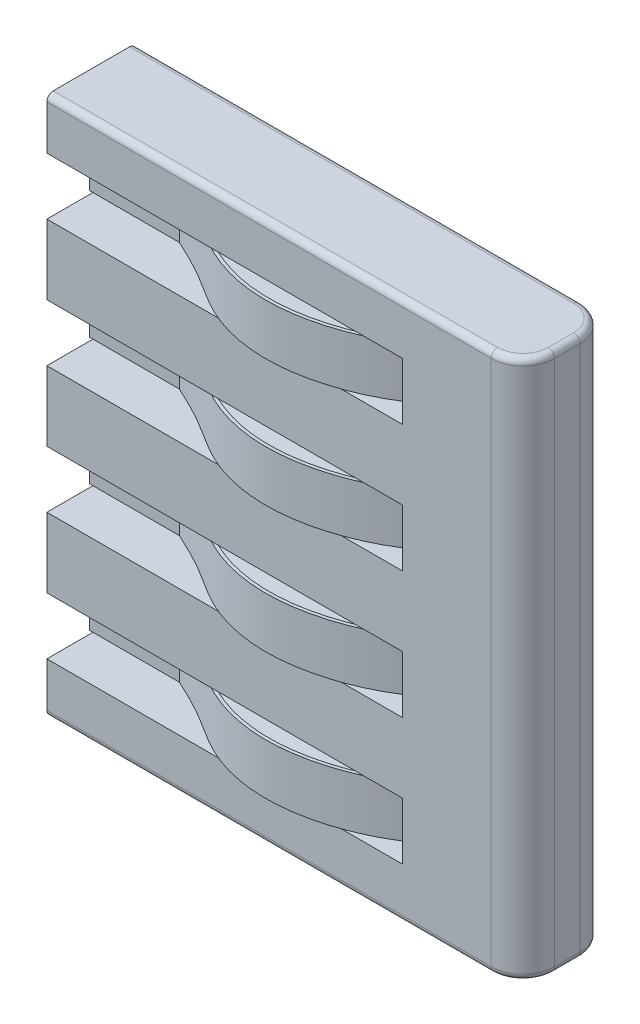
from build123d import *

# Parameters (mm, degrees)
SKETCH1_W           = 9.525
SKETCH1_H           = 10.795
BOSS_EXTRUDE1_DEPTH = 0.889
SKETCH2_W           = 7.112
SKETCH2_H           = 1.143
CUT_EXTRUDE1_DEPTH  = 1.27
LPATTERN1_COUNT     = 4
LPATTERN1_PITCH     = 2.54
SWEEP1_START        = 3.302
SWEEP1_DEPTH        = 1.016
LPATTERN2_COUNT     = 4
LPATTERN2_PITCH     = 2.54
CUT_EXTRUDE2_DEPTH  = 12.8580274
FILLET2_R           = 0.127


# Read off the part's stored shape, not the designer's step: Sweep1
with BuildPart() as part:
    # Sketch1 → Boss-Extrude1 (new, symmetric)
    with BuildSketch(Plane.XY):
        Rectangle(SKETCH1_W, SKETCH1_H)
    extrude(amount=BOSS_EXTRUDE1_DEPTH, both=True)

    # Sketch2 → Cut-Extrude1 (cut)
    with BuildSketch(Plane.XY.offset(0.889)):
        with Locations((-1.2065, 3.81)):
            Rectangle(SKETCH2_W, SKETCH2_H)
    cut_extrude1 = extrude(amount=-CUT_EXTRUDE1_DEPTH, mode=Mode.SUBTRACT)

    # LPattern1: Cut-Extrude1 ×4
    with Locations(*[(0, -i * LPATTERN1_PITCH, 0) for i in range(1, LPATTERN1_COUNT)]):
        add(cut_extrude1, mode=Mode.SUBTRACT)

    # Sweep1 outline → Sweep1 (add)
    with BuildSketch(Plane(origin=(0, 0, 0), x_dir=(1, 0, 0), z_dir=(0, 1, 0)).offset(SWEEP1_START)):
        with BuildLine():
            add(Edge.make_bspline(
                [(-2.958664485, 0.03175), (-2.706405798, -0.084396657), (-2.195293689, -0.319726362), (-1.514674501, -0.811036045), (-0.723468732, -1.093477281), (0.111091297, -1.1480463), (0.950883413, -0.99405052), (1.715489301, -0.68557292), (2.154910348, -0.386399802), (2.3495, -0.248288405)],
                knots=[0, 0, 0, 0, 0.1400972, 0.283856925, 0.421522391, 0.557109715, 0.701349819, 0.849245032, 0.969367335, 0.969367335, 0.969367335, 0.969367335], degree=3))
            Line((-2.958664485, 0.03175), (-4.7625, 0.03175))
            Line((-4.7625, 0.03175), (-4.7625, -0.03175))
            Line((-4.7625, -0.03175), (-2.968725914, -0.03175))
            add(Edge.make_bspline(
                [(-2.968725914, -0.03175), (-2.714491455, -0.15140088), (-2.19937615, -0.393830641), (-1.50930601, -0.887085656), (-0.710525949, -1.159958237), (0.131263589, -1.2104677), (0.978085908, -1.052203574), (1.73427594, -0.74581201), (2.165863748, -0.455666821), (2.3495, -0.326036057)],
                knots=[0, 0, 0, 0, 0.1400972, 0.283856925, 0.421522391, 0.557109715, 0.701349819, 0.849245032, 0.961516171, 0.961516171, 0.961516171, 0.961516171], degree=3))
            Line((2.3495, -0.326036057), (2.3495, -0.248288405))
        make_face()
    sweep1 = extrude(amount=SWEEP1_DEPTH)

    # LPattern2: Sweep1 ×4
    with Locations(*[(0, -i * LPATTERN2_PITCH, 0) for i in range(1, LPATTERN2_COUNT)]):
        add(sweep1)

    # Sketch5 → Cut-Extrude2 (cut, through all)
    with BuildSketch(Plane.XZ.offset(5.3975)):
        with BuildLine():
            Line((4.1275, 0.889), (4.830136411, 0.889))
            Line((4.830136411, 0.889), (4.830136411, -0.889))
            Line((4.830136411, -0.889), (4.1275, -0.889))
            ThreePointArc((4.1275, -0.889), (4.576512806, -0.703012806), (4.7625, -0.254))
            Line((4.7625, -0.254), (4.7625, 0.254))
            ThreePointArc((4.7625, 0.254), (4.576512806, 0.703012806), (4.1275, 0.889))
        make_face()
    extrude(amount=-CUT_EXTRUDE2_DEPTH, mode=Mode.SUBTRACT)

    # Fillet2
    fillet2_edges = [part.edges().sort_by_distance(p)[0] for p in [
        (-0.3175, -5.3975, 0.889),
        (-0.3175, 5.3975, -0.889),
        (-0.3175, 5.3975, 0.889),
        (4.7625, -5.3975, 0),
        (4.7625, 5.3975, 0),
        (4.576512806, -5.3975, 0.703012806),
        (4.576512806, -5.3975, -0.703012806),
        (4.576512806, 5.3975, -0.703012806),
        (4.576512806, 5.3975, 0.703012806),
        (-0.3175, -5.3975, -0.889),
    ]]
    fillet(fillet2_edges, radius=FILLET2_R)


solid = part.part
